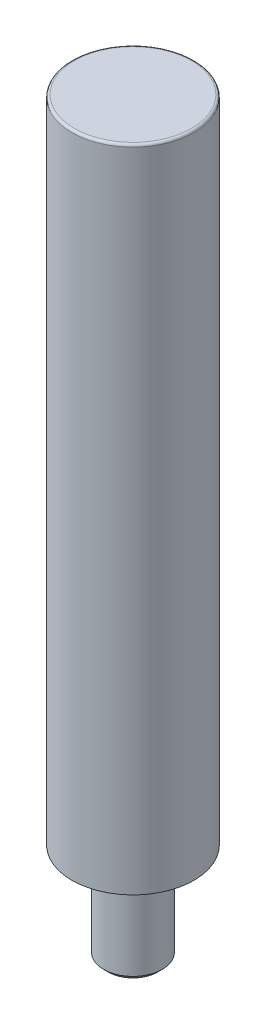
from build123d import *

# Parameters (mm, degrees)
SKETCH1_R           = 12.5
BOSS_EXTRUDE1_DEPTH = 133
SKETCH2_R           = 10
BOSS_EXTRUDE2_DEPTH = 20
FILLET1_R           = 0.5


# Read off the part's stored shape, not the designer's step: M12 Machine Threads Stud1
with BuildPart() as part:
    # Sketch1 → Boss-Extrude1 (new body)
    with BuildSketch(Plane(origin=(0, 0, 0), x_dir=(1, 0, 0), z_dir=(0, 1, 0))):
        with Locations(Location((0, 0, 0), (0, 0, 270))):
            Circle(SKETCH1_R)
    extrude(amount=BOSS_EXTRUDE1_DEPTH)

    # Sketch2 → Boss-Extrude2 (add)
    with BuildSketch(Plane.XZ):
        with Locations(Location((0, 0, 0), (0, 0, 270))):
            Circle(SKETCH2_R)
    extrude(amount=BOSS_EXTRUDE2_DEPTH)

    # M12 Machine Threads Stud1 outline → M12 Machine Threads Stud1 (revolve, cut)
    with BuildSketch(Plane.XY):
        Polygon((10, 0), (6, 0), (6, -19.036), (5.036, -20), (10, -20), align=None)
    revolve(axis=Axis((0, 0, 0), (0, 1, 0)), mode=Mode.SUBTRACT)

    # Fillet1
    fillet1_edges = [part.edges().sort_by_distance(p)[0] for p in [
        (0, 133, -12.5),
    ]]
    fillet(fillet1_edges, radius=FILLET1_R)


solid = part.part
